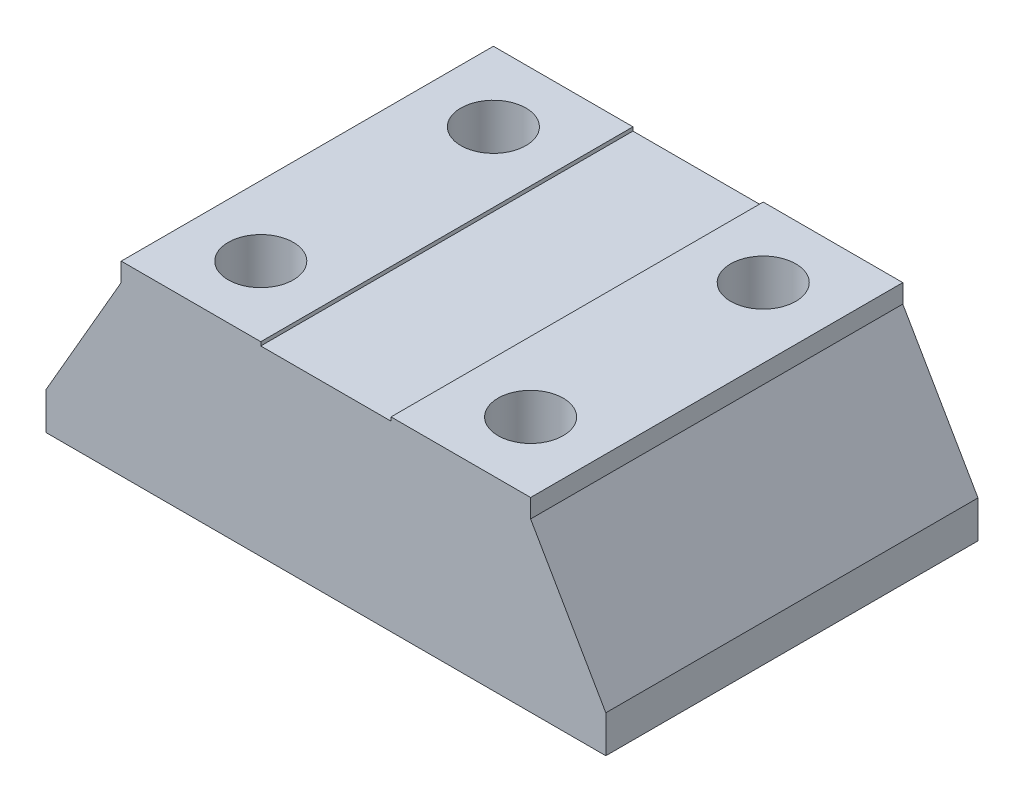
from build123d import *

# Parameters (mm, degrees)
ESTRUSIONE_ESTRUSIONE1_DEPTH = 10
SCHIZZO2_R                   = 1.75
TAGLIO_ESTRUSIONE1_DEPTH     = 21.645708387
SCHIZZO3_W                   = 7
SCHIZZO3_H                   = 20
TAGLIO_ESTRUSIONE2_DEPTH     = 0.2


with BuildPart() as part:
    # Schizzo1 → Estrusione-Estrusione1 (new, symmetric)
    with BuildSketch(Plane.XY):
        Polygon((11, 9), (11, 10), (-11, 10), (-11, 9), (-15.041451884, 2), (-15.041451884, 0), (15.041451884, 0), (15.041451884, 2), align=None)
    extrude(amount=ESTRUSIONE_ESTRUSIONE1_DEPTH, both=True)

    # Schizzo2 → Taglio-Estrusione1 (cut, through all)
    with BuildSketch(Plane(origin=(0, 10, 0), x_dir=(1, 0, 0), z_dir=(0, 1, 0))):
        with Locations((7.25, 6.25)):
            Circle(SCHIZZO2_R)
        with Locations((-7.25, 6.25)):
            Circle(SCHIZZO2_R)
        with Locations((-7.25, -6.25)):
            Circle(SCHIZZO2_R)
        with Locations((7.25, -6.25)):
            Circle(SCHIZZO2_R)
    extrude(amount=-TAGLIO_ESTRUSIONE1_DEPTH, mode=Mode.SUBTRACT)

    # Schizzo3 → Taglio-Estrusione2 (cut)
    with BuildSketch(Plane(origin=(0, 10, 0), x_dir=(1, 0, 0), z_dir=(0, 1, 0))):
        Rectangle(SCHIZZO3_W, SCHIZZO3_H)
    extrude(amount=-TAGLIO_ESTRUSIONE2_DEPTH, mode=Mode.SUBTRACT)


solid = part.part
